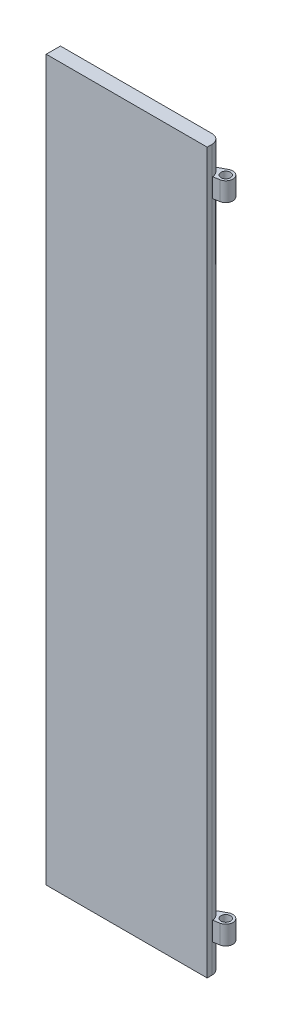
from build123d import *

# Parameters (mm, degrees)
SZKIC1_W                    = 340
SZKIC1_H                    = 1520
DODANIE_WYCI_GNI_CIE1_DEPTH = 30
ZAOKR_GLENIE1_R             = 20
DODANIE_WYCI_GNI_CIE2_START = -60
SZKIC3_R                    = 10
DODANIE_WYCI_GNI_CIE2_DEPTH = 40


with BuildPart() as part:
    # Szkic1 → Dodanie-wyciągnięcie1 (new body)
    with BuildSketch(Plane.XY):
        with Locations((170, 760)):
            Rectangle(SZKIC1_W, SZKIC1_H)
    extrude(amount=DODANIE_WYCI_GNI_CIE1_DEPTH)

    # Zaokrąglenie1
    zaokr_glenie1_edges = [part.edges().sort_by_distance(p)[0] for p in [
        (340, 760, 0),
    ]]
    fillet(zaokr_glenie1_edges, radius=ZAOKR_GLENIE1_R)

    # Szkic3 → Dodanie-wyciągnięcie2 (add)
    with BuildSketch(Plane(origin=(0, 1520, 0), x_dir=(1, 0, 0), z_dir=(0, 1, 0)).offset(DODANIE_WYCI_GNI_CIE2_START)):
        with BuildLine():
            Line((343.569035313, 11.852281682), (317.579761323, -2.01494605))
            Line((317.579761323, -2.01494605), (327.4713232, -20.553223259))
            Line((327.4713232, -20.553223259), (353.155081067, -16.167681746))
            ThreePointArc((353.155081067, -16.167681746), (364.822767091, 3.473753024), (343.569035313, 11.852281682))
        make_face()
        with Locations((350.630349014, -1.381684044)):
            Circle(SZKIC3_R, mode=Mode.SUBTRACT)
    dodanie_wyci_gni_cie2 = extrude(amount=-DODANIE_WYCI_GNI_CIE2_DEPTH)

    # Lustro1: Dodanie-wyciągnięcie2 across plane
    add(dodanie_wyci_gni_cie2.mirror(Plane(origin=(0, 760, 0), x_dir=(0, 0, 1), z_dir=(0, -1, 0))))


solid = part.part
